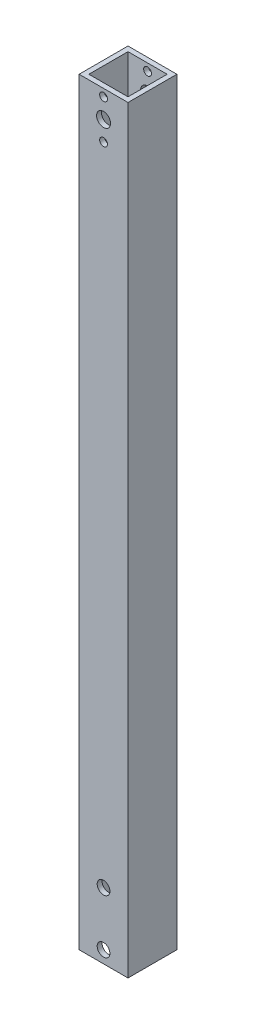
from build123d import *

# Parameters (mm, degrees)
ESBO_O1_W             = 20
ESBO_O1_H             = 20
ESBO_O1_W_2           = 16
ESBO_O1_H_2           = 16
EXTRUS_O_FINA1_DEPTH  = 310
ESBO_O4_R             = 2.85
ESBO_O4_R_2           = 1.6
CORTE_EXTRUS_O2_DEPTH = 312.287648325
ESBO_O5_R             = 2.6
CORTE_EXTRUS_O5_DEPTH = 312.287648325


with BuildPart() as part:
    # Esboço1 → Extrusão-Fina1 (new body)
    with BuildSketch(Plane(origin=(0, 0, 0), x_dir=(1, 0, 0), z_dir=(0, 1, 0))):
        with Locations((10, 10)):
            Rectangle(ESBO_O1_W, ESBO_O1_H)
        with Locations((10, 10)):
            Rectangle(ESBO_O1_W_2, ESBO_O1_H_2, mode=Mode.SUBTRACT)
    extrude(amount=EXTRUS_O_FINA1_DEPTH)

    # Esboço4 → Corte-extrusão2 (cut, through all)
    with BuildSketch(Plane.XY):
        with Locations((10, 299)):
            Circle(ESBO_O4_R)
        with Locations((10, 291)):
            Circle(ESBO_O4_R_2)
        with Locations((10, 307)):
            Circle(ESBO_O4_R_2)
    extrude(amount=-CORTE_EXTRUS_O2_DEPTH, mode=Mode.SUBTRACT)

    # Esboço5 → Corte-extrusão5 (cut, through all)
    with BuildSketch(Plane(origin=(0, 0, -20), x_dir=(-1, 0, 0), z_dir=(0, 0, -1))):
        with Locations((-10, 5)):
            Circle(ESBO_O5_R)
        with Locations((-10, 27)):
            Circle(ESBO_O5_R)
    extrude(amount=-CORTE_EXTRUS_O5_DEPTH, mode=Mode.SUBTRACT)


solid = part.part
